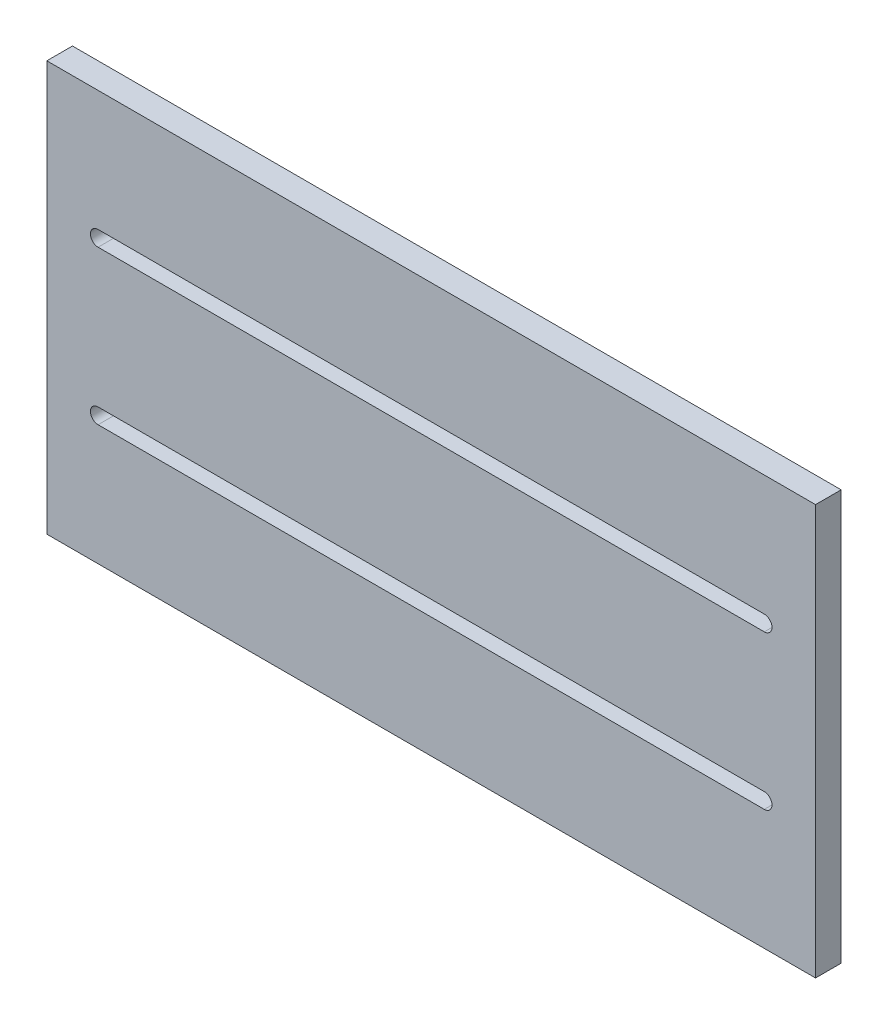
from build123d import *

# Parameters (mm, degrees)
SKETCH1_W           = 190.5
SKETCH1_H           = 6.35
BOSS_EXTRUDE1_DEPTH = 101.6
CUT_EXTRUDE1_DEPTH  = 216.993362167


with BuildPart() as part:
    # Sketch1 → Boss-Extrude1 (new body)
    with BuildSketch(Plane(origin=(0, 0, 0), x_dir=(1, 0, 0), z_dir=(0, 1, 0))):
        with Locations((95.25, 3.175)):
            Rectangle(SKETCH1_W, SKETCH1_H)
    extrude(amount=BOSS_EXTRUDE1_DEPTH)

    # Sketch2 → Cut-Extrude1 (cut, through all)
    with BuildSketch(Plane(origin=(0, 0, -6.35), x_dir=(-1, 0, 0), z_dir=(0, 0, -1))):
        with BuildLine():
            Line((-177.8, 71.755), (-12.7, 71.755))
            ThreePointArc((-12.7, 71.755), (-10.795, 69.85), (-12.7, 67.945))
            Line((-12.7, 67.945), (-177.8, 67.945))
            ThreePointArc((-177.8, 67.945), (-179.705, 69.85), (-177.8, 71.755))
        make_face()
        with BuildLine():
            Line((-177.8, 33.655), (-12.7, 33.655))
            ThreePointArc((-12.7, 33.655), (-10.795, 31.75), (-12.7, 29.845))
            Line((-12.7, 29.845), (-177.8, 29.845))
            ThreePointArc((-177.8, 29.845), (-179.705, 31.75), (-177.8, 33.655))
        make_face()
    extrude(amount=-CUT_EXTRUDE1_DEPTH, mode=Mode.SUBTRACT)


solid = part.part
